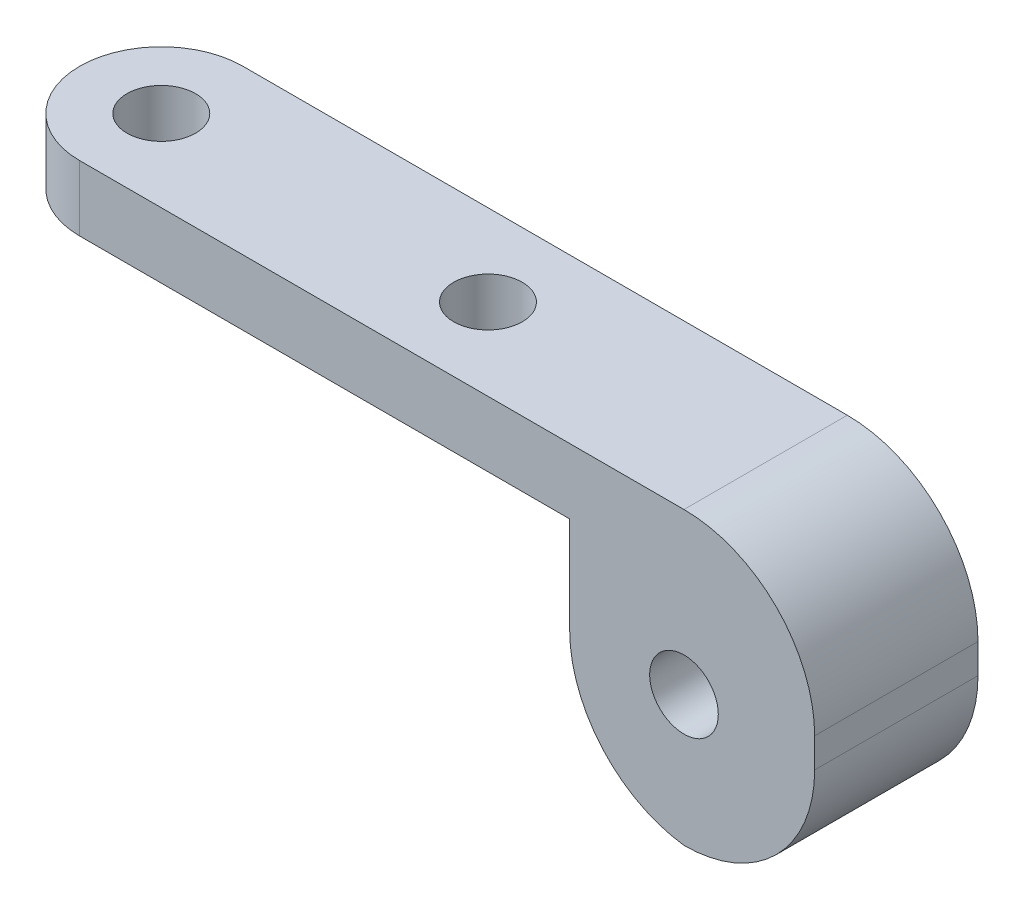
from build123d import *

# Parameters (mm, degrees)
SKETCH1_R                = 1.05
BOSS_EXTRUDE1_DEPTH      = 2
SKETCH2_R                = 1.05
CUT_EXTRUDE1_DEPTH       = 23.726636355
BOSS_EXTRUDE2_DEPTH      = 6.905
BOSS_EXTRUDE2_DEPTH_BACK = 2
SKETCH4_W                = 7.5
SKETCH4_H                = 5
FILLET1_R                = 4
SKETCH5_R                = 1.05
CUT_EXTRUDE2_DEPTH       = 14
FILLET2_R                = 4


with BuildPart() as part:
    # Sketch1 → Boss-Extrude1 (new body)
    with BuildSketch(Plane(origin=(0, 0, 0), x_dir=(1, 0, 0), z_dir=(0, 1, 0))):
        with BuildLine():
            Line((0, 2.5), (20, 2.5))
            ThreePointArc((20, 2.5), (22.5, 0), (20, -2.5))
            Line((20, -2.5), (0, -2.5))
            ThreePointArc((0, -2.5), (-2.5, 0), (0, 2.5))
        make_face()
        with Locations(Location((0, 0, 0), (0, 0, 270))):
            Circle(SKETCH1_R, mode=Mode.SUBTRACT)
        with Locations(Location((20, 0, 0), (0, 0, 270))):
            Circle(SKETCH1_R, mode=Mode.SUBTRACT)
    extrude(amount=BOSS_EXTRUDE1_DEPTH)

    # Sketch2 → Cut-Extrude1 (cut, through all)
    with BuildSketch(Plane(origin=(0, 2, 0), x_dir=(1, 0, 0), z_dir=(0, 1, 0))):
        with Locations(Location((10, 0, 0), (0, 0, 270))):
            Circle(SKETCH2_R)
    extrude(amount=-CUT_EXTRUDE1_DEPTH, mode=Mode.SUBTRACT)

    # Sketch4 → Boss-Extrude2 (add, two sides: drawn at the far end of the back side and taken through both)
    with BuildSketch(Plane.XZ.offset(-BOSS_EXTRUDE2_DEPTH_BACK)):
        with Locations((18.75, 0)):
            Rectangle(SKETCH4_W, SKETCH4_H)
    extrude(amount=BOSS_EXTRUDE2_DEPTH + BOSS_EXTRUDE2_DEPTH_BACK)

    # Fillet1
    fillet1_edges = [part.edges().sort_by_distance(p)[0] for p in [
        (22.5, 2, -1.25),
        (22.5, -6.905, 0),
    ]]
    fillet(fillet1_edges, radius=FILLET1_R)

    # Sketch5 → Cut-Extrude2 (cut)
    with BuildSketch(Plane.XY.offset(2.5)):
        with Locations((18.5, -2.905)):
            Circle(SKETCH5_R)
    extrude(amount=-CUT_EXTRUDE2_DEPTH, mode=Mode.SUBTRACT)

    # Fillet2
    # the kernel refuses this fillet: 4 mm, written as the material it takes off along each edge
    with BuildSketch(Plane(origin=(15, -6.905, -12.421567416), x_dir=(0, 1, 0), z_dir=(0, 0, 1))) as fillet2_piece_1:
        with BuildLine():
            CenterArc((3.968626967, -4), FILLET2_R, 90, 82.819244219)
            Line((0, -3.5), (-0.079372539, -3.49))
            ThreePointArc((-0.079372539, -3.49), (-0.08, -1.75), (-0.08, 0))
            Line((-0.08, 0), (0, 0.08))
            Line((0, 0.08), (3.968626967, 0.08))
            Line((3.968626967, 0.08), (3.968626967, 0))
        make_face()
    extrude(amount=24.843134833, mode=Mode.SUBTRACT)


solid = part.part
